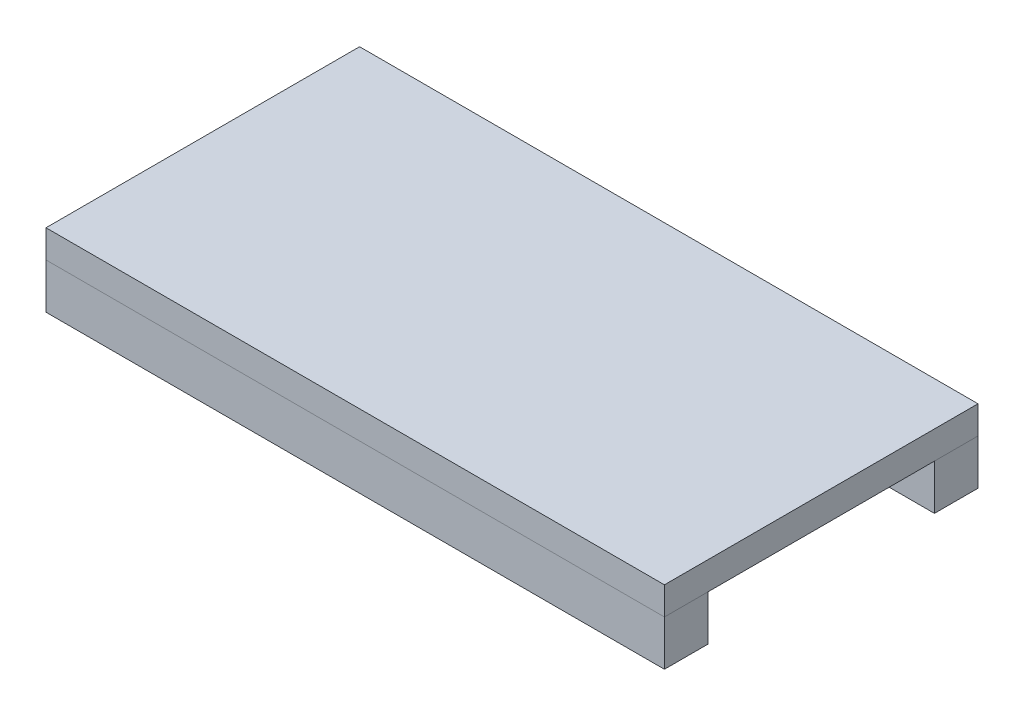
from build123d import *

# Parameters (mm, degrees)
SKETCH1_W             = 35.5
SKETCH1_H             = 18
BOSS_EXTRUDE1_DEPTH   = 1.6
SKETCH2_W             = 35.5
SKETCH2_H             = 2.5
BOSS_EXTRUDE2_DEPTH   = 2.6
BOSS_EXTRUDE2_2_DEPTH = 2.6


with BuildPart() as part:
    # Sketch1 → Boss-Extrude1 (new body)
    with BuildSketch(Plane(origin=(0, 0, 0), x_dir=(1, 0, 0), z_dir=(0, 1, 0))):
        Rectangle(SKETCH1_W, SKETCH1_H)
    extrude(amount=BOSS_EXTRUDE1_DEPTH)


with BuildPart() as body_2:
    # Sketch2 → Boss-Extrude2 (new body)
    with BuildSketch(Plane.XZ):
        with Locations((0, 7.75)):
            Rectangle(SKETCH2_W, SKETCH2_H)
    extrude(amount=BOSS_EXTRUDE2_DEPTH)


with BuildPart() as body_3:
    # Sketch2 → Boss-Extrude2 2 (new body)
    with BuildSketch(Plane.XZ):
        with Locations((0, -7.75)):
            Rectangle(SKETCH2_W, SKETCH2_H)
    extrude(amount=BOSS_EXTRUDE2_2_DEPTH)


solid = Compound([part.part, body_2.part, body_3.part])
